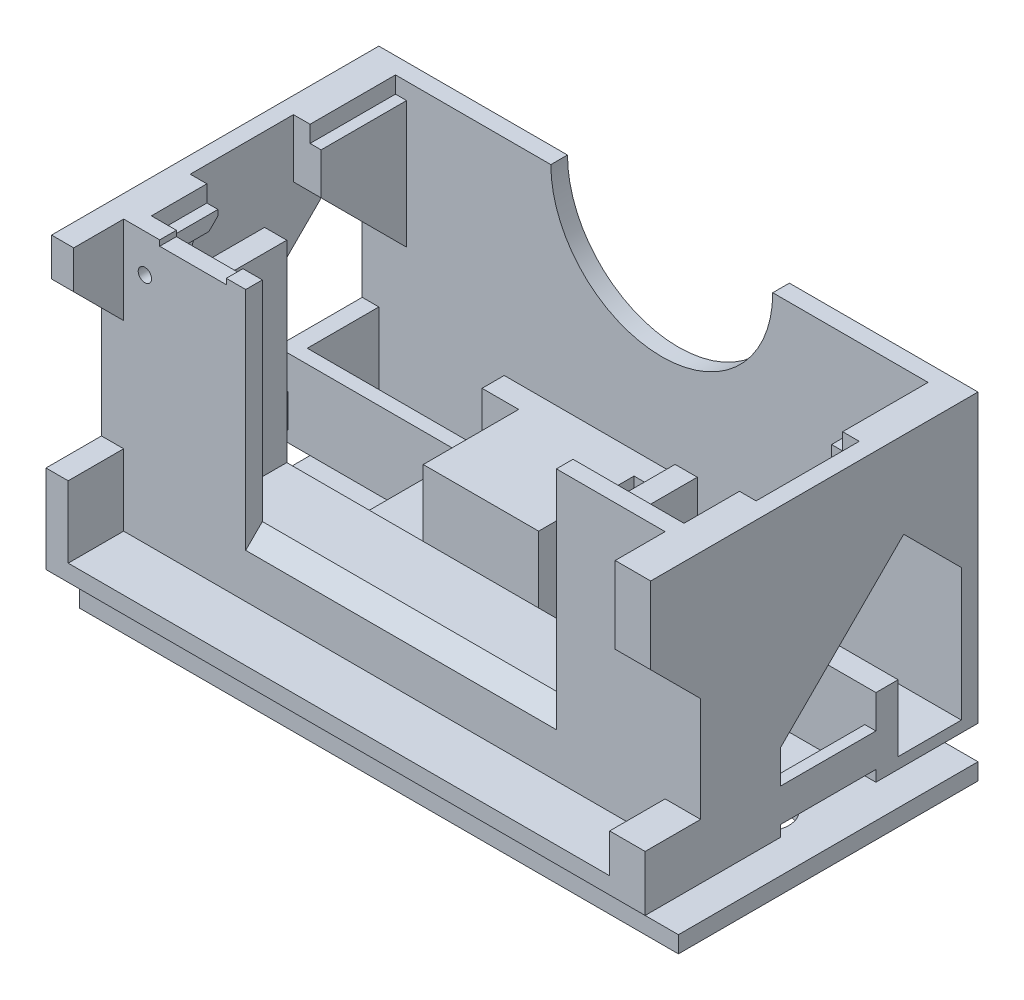
from build123d import *

# Parameters (mm, degrees)
SKETCH1_W                      = 54
SKETCH1_H                      = 27
BOSS_EXTRUDE1_DEPTH            = 1.5
CUT_EXTRUDE1_REACH             = 62.392
SKETCH2_R                      = 2.25
CUT_EXTRUDE1_DIRECTION_2_DEPTH = 61.392466418
SKETCH3_W                      = 26.4
SKETCH3_H                      = 30
BOSS_EXTRUDE2_DEPTH            = 3
CHAMFER3_SIZE                  = 3
BOSS_EXTRUDE3_DEPTH            = 7
SKETCH25_W                     = 8.6
SKETCH25_H                     = 3
BOSS_EXTRUDE19_DEPTH           = 1
BOSS_EXTRUDE15_START           = 7
SKETCH4_4_W                    = 10.4
SKETCH4_4_H                    = 8.6
BOSS_EXTRUDE15_DEPTH           = 6
SKETCH5_W                      = 54
SKETCH5_H                      = 1.5
BOSS_EXTRUDE5_DEPTH            = 18.86
SKETCH5_3_W                    = 2
SKETCH5_3_H                    = 5.7
BOSS_EXTRUDE6_DEPTH            = 17.36
SKETCH4_3_W                    = 8
SKETCH4_3_H                    = 8.6
BOSS_EXTRUDE12_DEPTH           = 3.86
SKETCH17_W                     = 2
SKETCH17_H                     = 6.43
SKETCH17_W_2                   = 3.2
SKETCH17_H_2                   = 3.5
BOSS_EXTRUDE13_DEPTH           = 5
SKETCH17_3_W                   = 2
SKETCH17_3_H                   = 7.93
SKETCH17_3_W_2                 = 3.2
SKETCH17_3_H_2                 = 11.43
BOSS_EXTRUDE16_DEPTH           = 4.5
CHAMFER7_SIZE                  = 4.5
SKETCH5_4_W                    = 54
SKETCH5_4_H                    = 1.5
BOSS_EXTRUDE8_DEPTH            = 18.86
BOSS_EXTRUDE9_DEPTH            = 1.5
SKETCH18_W                     = 4
SKETCH18_H                     = 7.7
BOSS_EXTRUDE14_DEPTH           = 13
SKETCH18_3_W                   = 2.5
SKETCH18_3_H                   = 5
BOSS_EXTRUDE17_DEPTH           = 7
CHAMFER8_SIZE                  = 5
CHAMFER6_SIZE                  = 7.75
SKETCH20_W                     = 1
SKETCH20_H                     = 7.7
SKETCH20_H_2                   = 5
CUT_EXTRUDE7_DEPTH             = 1.5
SKETCH22_W                     = 6
SKETCH22_H                     = 1.5
CUT_EXTRUDE10_DEPTH            = 0.5
SKETCH12_W                     = 28
SKETCH12_H                     = 18.86
CUT_EXTRUDE2_DEPTH             = 7.2
CUT_EXTRUDE3_DEPTH             = 1.5
SKETCH15_W                     = 9
SKETCH15_H                     = 2
BOSS_EXTRUDE11_DEPTH           = 6
SKETCH21_W                     = 18.5
SKETCH21_H                     = 5.7
SKETCH21_H_2                   = 0.75
CUT_EXTRUDE8_DEPTH             = 6
CUT_EXTRUDE9_START             = -6
SKETCH21_3_W                   = 18.5
SKETCH21_3_H                   = 5.7
SKETCH21_3_H_2                 = 0.75
CUT_EXTRUDE9_DEPTH             = 1
FILLET7_R                      = 1
CUT_EXTRUDE11_REACH            = 68.804
SKETCH23_R                     = 0.6
CHAMFER9_SIZE                  = 1.5
BOSS_EXTRUDE18_REACH           = 67.757
SKETCH24_W                     = 1.5
SKETCH24_H                     = 7


# Some blends are built 0.0001 mm under size
with BuildPart() as part:
    # Sketch1 → Boss-Extrude1 (new body)
    with BuildSketch(Plane(origin=(0, 0, 0), x_dir=(1, 0, 0), z_dir=(0, 1, 0))):
        with Locations((27, 13.5)):
            Rectangle(SKETCH1_W, SKETCH1_H)
    extrude(amount=BOSS_EXTRUDE1_DEPTH)

    # Sketch2 → Cut-Extrude1 (cut, up to next)
    with BuildSketch(Plane(origin=(0, 1.5, 0), x_dir=(1, 0, 0), z_dir=(0, 1, 0)), mode=Mode.PRIVATE) as cut_extrude1_sk1:
        with Locations(Location((5.8, 13.5, 0), (0, 0, 90))):
            Circle(SKETCH2_R)
    cut_extrude1_tool1 = extrude(cut_extrude1_sk1.sketch, amount=-CUT_EXTRUDE1_REACH, mode=Mode.PRIVATE) & part.part
    cut_extrude1 = cut_extrude1_tool1.solids().sort_by_distance((5.8, 1.5, -13.5))[0]
    add(cut_extrude1, mode=Mode.SUBTRACT)

    # Sketch2 → Cut-Extrude1 direction 2 (cut)
    with BuildSketch(Plane(origin=(0, 1.5, 0), x_dir=(1, 0, 0), z_dir=(0, 1, 0))):
        with Locations(Location((5.8, 13.5, 0), (0, 0, 90))):
            Circle(SKETCH2_R)
    cut_extrude1_direction_2 = extrude(amount=CUT_EXTRUDE1_DIRECTION_2_DEPTH, mode=Mode.SUBTRACT)

    # Mirror1: Cut-Extrude1, Cut-Extrude1 direction 2 across plane
    add(cut_extrude1.mirror(Plane.ZY.offset(-27)), mode=Mode.SUBTRACT)
    add(cut_extrude1_direction_2.mirror(Plane.ZY.offset(-27)), mode=Mode.SUBTRACT)

    # Sketch3 → Boss-Extrude2 (add)
    with BuildSketch(Plane(origin=(0, 1.5, 0), x_dir=(1, 0, 0), z_dir=(0, 1, 0))):
        with Locations((27, 12)):
            Rectangle(SKETCH3_W, SKETCH3_H)
    extrude(amount=BOSS_EXTRUDE2_DEPTH)

    # Chamfer3
    chamfer3_edges = [part.edges().sort_by_distance(p)[0] for p in [
        (27, 1.5, 3),
    ]]
    chamfer(chamfer3_edges, length=CHAMFER3_SIZE - 0.0001)  # a hair under: the kernel refuses the full size

    # Sketch4 → Boss-Extrude3 (add)
    with BuildSketch(Plane(origin=(0, 4.5, 0), x_dir=(1, 0, 0), z_dir=(0, 1, 0))):
        Polygon((54, 27), (0, 27), (0, 17.8), (21.8, 17.8), (21.8, 9.2), (0, 9.2), (0, 2), (54, 2), (54, 9.2), (32.2, 9.2), (32.2, 17.8), (54, 17.8), align=None)
    extrude(amount=BOSS_EXTRUDE3_DEPTH)

    # Sketch25 → Boss-Extrude19 (add)
    with BuildSketch(Plane(origin=(54, 0, 0), x_dir=(0, 0, -1), z_dir=(1, 0, 0))):
        with Locations((13.5, 7)):
            Rectangle(SKETCH25_W, SKETCH25_H)
    boss_extrude19 = extrude(amount=-BOSS_EXTRUDE19_DEPTH)

    # Mirror6: Boss-Extrude19 across plane
    add(boss_extrude19.mirror(Plane.ZY.offset(-27)))

    # Sketch4<4> → Boss-Extrude15 (add)
    with BuildSketch(Plane(origin=(0, 4.5, 0), x_dir=(1, 0, 0), z_dir=(0, 1, 0)).offset(BOSS_EXTRUDE15_START)):
        with Locations((27, 13.5)):
            Rectangle(SKETCH4_4_W, SKETCH4_4_H)
    extrude(amount=BOSS_EXTRUDE15_DEPTH)

    # Sketch5 → Boss-Extrude5 (add)
    with BuildSketch(Plane(origin=(0, 11.5, 0), x_dir=(1, 0, 0), z_dir=(0, 1, 0))):
        with Locations((27, 2.75)):
            Rectangle(SKETCH5_W, SKETCH5_H)
    extrude(amount=BOSS_EXTRUDE5_DEPTH)

    # Sketch5<3> → Boss-Extrude6 (add)
    with BuildSketch(Plane(origin=(0, 11.5, 0), x_dir=(1, 0, 0), z_dir=(0, 1, 0))):
        with Locations((45.5, 6.35)):
            Rectangle(SKETCH5_3_W, SKETCH5_3_H)
        with Locations((8.5, 6.35)):
            Rectangle(SKETCH5_3_W, SKETCH5_3_H)
    extrude(amount=BOSS_EXTRUDE6_DEPTH)

    # Sketch4<3> → Boss-Extrude12 (add)
    with BuildSketch(Plane(origin=(0, 4.5, 0), x_dir=(1, 0, 0), z_dir=(0, 1, 0))):
        with Locations((17.8, 13.5)):
            Rectangle(SKETCH4_3_W, SKETCH4_3_H)
        with Locations((36.2, 13.5)):
            Rectangle(SKETCH4_3_W, SKETCH4_3_H)
    extrude(amount=BOSS_EXTRUDE12_DEPTH)

    # Sketch17 → Boss-Extrude13 (add)
    with BuildSketch(Plane.XY.offset(-2)):
        with Locations((1, 9.215)):
            Rectangle(SKETCH17_W, SKETCH17_H)
        Polygon((0, 6), (0, 4.5), (13.8, 4.5), (40.2, 4.5), (54, 4.5), (54, 6), (50.8, 6), (2, 6), align=None)
        with Locations((52.4, 7.75)):
            Rectangle(SKETCH17_W_2, SKETCH17_H_2)
    extrude(amount=BOSS_EXTRUDE13_DEPTH)

    # Sketch17<3> → Boss-Extrude16 (add)
    with BuildSketch(Plane.XY.offset(-2)):
        with Locations((1, 26.395)):
            Rectangle(SKETCH17_3_W, SKETCH17_3_H)
        with Locations((52.4, 24.645)):
            Rectangle(SKETCH17_3_W_2, SKETCH17_3_H_2)
    extrude(amount=BOSS_EXTRUDE16_DEPTH)

    # Chamfer7
    chamfer7_edges = [part.edges().sort_by_distance(p)[0] for p in [
        (52.4, 18.93, 2.5),
        (1, 22.43, 2.5),
    ]]
    chamfer(chamfer7_edges, length=CHAMFER7_SIZE - 0.0001)  # a hair under: the kernel refuses the full size

    # Sketch5<4> → Boss-Extrude8 (add)
    with BuildSketch(Plane(origin=(0, 11.5, 0), x_dir=(1, 0, 0), z_dir=(0, 1, 0))):
        with Locations((27, 26.25)):
            Rectangle(SKETCH5_4_W, SKETCH5_4_H)
    extrude(amount=BOSS_EXTRUDE8_DEPTH)

    # Sketch10 → Boss-Extrude9 (add)
    with BuildSketch(Plane.ZY):
        Polygon((-3.5, 11.5), (-3.5, 30.36), (-25.5, 30.36), (-25.5, 27.8), (-9.2, 11.5), align=None)
    boss_extrude9 = extrude(amount=-BOSS_EXTRUDE9_DEPTH)

    # Mirror3: Boss-Extrude9 across plane
    add(boss_extrude9.mirror(Plane.ZY.offset(-27)))

    # Sketch18 → Boss-Extrude14 (add)
    with BuildSketch(Plane(origin=(0, 30.36, 0), x_dir=(1, 0, 0), z_dir=(0, 1, 0))):
        with Locations((2, 21.65)):
            Rectangle(SKETCH18_W, SKETCH18_H)
        with Locations((52, 21.65)):
            Rectangle(SKETCH18_W, SKETCH18_H)
    extrude(amount=-BOSS_EXTRUDE14_DEPTH)

    # Sketch18<3> → Boss-Extrude17 (add)
    with BuildSketch(Plane(origin=(0, 30.36, 0), x_dir=(1, 0, 0), z_dir=(0, 1, 0))):
        with Locations((51.25, 6)):
            Rectangle(SKETCH18_3_W, SKETCH18_3_H)
        with Locations((2.75, 6)):
            Rectangle(SKETCH18_3_W, SKETCH18_3_H)
    extrude(amount=-BOSS_EXTRUDE17_DEPTH)

    # Chamfer8
    chamfer8_edges = [part.edges().sort_by_distance(p)[0] for p in [
        (51.25, 23.36, -8.5),
        (2.75, 23.36, -8.5),
    ]]
    chamfer(chamfer8_edges, length=CHAMFER8_SIZE - 0.0001)  # a hair under: the kernel refuses the full size

    # Chamfer6
    # the kernel refuses this chamfer: 7.75 mm, written as the material it takes off along each edge
    with BuildSketch(Plane(origin=(-19.930543157, 17.36, -17.8), x_dir=(0, 0.9996219169112968, 0.027495876610586188), z_dir=(1, 0, 0))) as chamfer6_piece_1_section:
        Polygon((CHAMFER6_SIZE * 0.999621916911, -CHAMFER6_SIZE * 0.0274958766106), (-CHAMFER6_SIZE * 0.0274958766106, -CHAMFER6_SIZE * 0.999621916911), (0, 0), align=None)
    chamfer6_piece_1 = extrude(amount=43.861086313, mode=Mode.PRIVATE)
    chamfer6_piece_1 = split(chamfer6_piece_1, bisect_by=Plane(origin=(0.75, 21.216778897, -18.916778897), z_dir=(0, -0.7071067811865515, -0.7071067811865436)), keep=Keep.TOP, mode=Mode.PRIVATE)
    chamfer6_piece_1 = split(chamfer6_piece_1, bisect_by=Plane(origin=(0.75, 19.326101078, -25.5), z_dir=(0, 0, 1)), keep=Keep.TOP, mode=Mode.PRIVATE)
    add(chamfer6_piece_1, mode=Mode.SUBTRACT)
    with BuildSketch(Plane(origin=(-19.930543157, 17.36, -17.8), x_dir=(0, 0.9996219169112968, 0.027495876610586188), z_dir=(1, 0, 0))) as chamfer6_piece_2_section:
        Polygon((CHAMFER6_SIZE * 0.999621916911, -CHAMFER6_SIZE * 0.0274958766106), (-CHAMFER6_SIZE * 0.0274958766106, -CHAMFER6_SIZE * 0.999621916911), (0, 0), align=None)
    chamfer6_piece_2 = extrude(amount=43.861086313, mode=Mode.PRIVATE)
    chamfer6_piece_2 = split(chamfer6_piece_2, bisect_by=Plane(origin=(1.5, 22.605, -18.635), z_dir=(1, 0, 0)), keep=Keep.TOP, mode=Mode.PRIVATE)
    chamfer6_piece_2 = split(chamfer6_piece_2, bisect_by=Plane(origin=(2.75, 17.5, -18.635), z_dir=(0, 1, 0)), keep=Keep.TOP, mode=Mode.PRIVATE)
    add(chamfer6_piece_2, mode=Mode.SUBTRACT)
    with BuildSketch(Plane(origin=(30.069456843, 17.36, -17.8), x_dir=(0, 0.9996219169112968, 0.027495876610586188), z_dir=(1, 0, 0))) as chamfer6_piece_3_section:
        Polygon((CHAMFER6_SIZE * 0.999621916911, -CHAMFER6_SIZE * 0.0274958766106), (-CHAMFER6_SIZE * 0.0274958766106, -CHAMFER6_SIZE * 0.999621916911), (0, 0), align=None)
    chamfer6_piece_3 = extrude(amount=43.861086313, mode=Mode.PRIVATE)
    chamfer6_piece_3 = split(chamfer6_piece_3, bisect_by=Plane(origin=(51.25, 22.605, -25.5), z_dir=(0, 0, 1)), keep=Keep.TOP, mode=Mode.PRIVATE)
    chamfer6_piece_3 = split(chamfer6_piece_3, bisect_by=Plane(origin=(52.5, 22.605, -18.635), z_dir=(-1, 0, 0)), keep=Keep.TOP, mode=Mode.PRIVATE)
    add(chamfer6_piece_3, mode=Mode.SUBTRACT)
    with BuildSketch(Plane(origin=(30.069456843, 17.36, -17.8), x_dir=(0, 0.9996219169112968, 0.027495876610586188), z_dir=(1, 0, 0))) as chamfer6_piece_4_section:
        Polygon((CHAMFER6_SIZE * 0.999621916911, -CHAMFER6_SIZE * 0.0274958766106), (-CHAMFER6_SIZE * 0.0274958766106, -CHAMFER6_SIZE * 0.999621916911), (0, 0), align=None)
    chamfer6_piece_4 = extrude(amount=43.861086313, mode=Mode.PRIVATE)
    chamfer6_piece_4 = split(chamfer6_piece_4, bisect_by=Plane(origin=(53.25, 19.326101078, -25.5), z_dir=(0, 0, 1)), keep=Keep.TOP, mode=Mode.PRIVATE)
    chamfer6_piece_4 = split(chamfer6_piece_4, bisect_by=Plane(origin=(53.25, 21.216778897, -18.916778897), z_dir=(0, -0.7071067811865515, -0.7071067811865436)), keep=Keep.TOP, mode=Mode.PRIVATE)
    add(chamfer6_piece_4, mode=Mode.SUBTRACT)

    # Sketch20 → Cut-Extrude7 (cut)
    with BuildSketch(Plane(origin=(0, 30.36, 0), x_dir=(1, 0, 0), z_dir=(0, 1, 0))):
        with Locations((3.5, 21.65)):
            Rectangle(SKETCH20_W, SKETCH20_H)
        with Locations((50.5, 21.65)):
            Rectangle(SKETCH20_W, SKETCH20_H)
        with Locations((3.5, 6)):
            Rectangle(SKETCH20_W, SKETCH20_H_2)
        with Locations((50.5, 6)):
            Rectangle(SKETCH20_W, SKETCH20_H_2)
    extrude(amount=-CUT_EXTRUDE7_DEPTH, mode=Mode.SUBTRACT)

    # Sketch22 → Cut-Extrude10 (cut)
    with BuildSketch(Plane(origin=(0, 30.36, 0), x_dir=(1, 0, 0), z_dir=(0, 1, 0))):
        with Locations((8.25, 2.75)):
            Rectangle(SKETCH22_W, SKETCH22_H)
    extrude(amount=-CUT_EXTRUDE10_DEPTH, mode=Mode.SUBTRACT)

    # Sketch12 → Cut-Extrude2 (cut)
    with BuildSketch(Plane.XY.offset(-2)):
        with Locations((27, 20.93)):
            Rectangle(SKETCH12_W, SKETCH12_H)
    extrude(amount=-CUT_EXTRUDE2_DEPTH, mode=Mode.SUBTRACT)

    # Sketch14 → Cut-Extrude3 (cut)
    with BuildSketch(Plane(origin=(0, 0, -27), x_dir=(-1, 0, 0), z_dir=(0, 0, -1))):
        with BuildLine():
            ThreePointArc((-17, 30.36), (-27, 40.36), (-37, 30.36))
            Line((-37, 30.36), (-17, 30.36))
        make_face()
        with BuildLine():
            Line((-17, 30.36), (-37, 30.36))
            ThreePointArc((-37, 30.36), (-27, 20.36), (-17, 30.36))
        make_face()
    extrude(amount=-CUT_EXTRUDE3_DEPTH, mode=Mode.SUBTRACT)

    # Sketch15 → Boss-Extrude11 (add)
    with BuildSketch(Plane(origin=(0, 11.5, 0), x_dir=(1, 0, 0), z_dir=(0, 1, 0))):
        with Locations((23, 18.8)):
            Rectangle(SKETCH15_W, SKETCH15_H)
    boss_extrude11 = extrude(amount=BOSS_EXTRUDE11_DEPTH)

    # Mirror5: Boss-Extrude11 across plane
    add(boss_extrude11.mirror(Plane.ZY.offset(-27)))

    # Sketch21 → Cut-Extrude8 (cut)
    with BuildSketch(Plane(origin=(0, 11.5, 0), x_dir=(1, 0, 0), z_dir=(0, 1, 0))):
        Polygon((54, 25.5), (18.5, 25.5), (18.5, 19.8), (35.5, 19.8), (54, 19.8), align=None)
        with Locations((9.25, 22.65)):
            Rectangle(SKETCH21_W, SKETCH21_H)
        with Locations((9.25, 19.425)):
            Rectangle(SKETCH21_W, SKETCH21_H_2)
    extrude(amount=-CUT_EXTRUDE8_DEPTH, mode=Mode.SUBTRACT)

    # Sketch21<3> → Cut-Extrude9 (cut)
    with BuildSketch(Plane(origin=(0, 11.5, 0), x_dir=(1, 0, 0), z_dir=(0, 1, 0)).offset(CUT_EXTRUDE9_START)):
        with Locations((9.25, 22.65)):
            Rectangle(SKETCH21_3_W, SKETCH21_3_H)
        with Locations((9.25, 19.425)):
            Rectangle(SKETCH21_3_W, SKETCH21_3_H_2)
    extrude(amount=-CUT_EXTRUDE9_DEPTH, mode=Mode.SUBTRACT)

    # Fillet7
    fillet7_edges = [part.edges().sort_by_distance(p)[0] for p in [
        (1.5, 17.43, -3.5),
        (52.5, 17.43, -3.5),
    ]]
    fillet(fillet7_edges, radius=FILLET7_R)

    # Sketch23 → Cut-Extrude11 (cut, up to next)
    with BuildSketch(Plane.XY.offset(-2), mode=Mode.PRIVATE) as cut_extrude11_sk1:
        with Locations((3.91, 26.95)):
            Circle(SKETCH23_R)
    cut_extrude11_tool1 = extrude(cut_extrude11_sk1.sketch, amount=-CUT_EXTRUDE11_REACH, mode=Mode.PRIVATE) & part.part
    # Sketch23 → Cut-Extrude11 (cut, up to next)
    with BuildSketch(Plane.XY.offset(-2), mode=Mode.PRIVATE) as cut_extrude11_sk2:
        with Locations((48.89, 26.95)):
            Circle(SKETCH23_R)
    cut_extrude11_tool2 = extrude(cut_extrude11_sk2.sketch, amount=-CUT_EXTRUDE11_REACH, mode=Mode.PRIVATE) & part.part
    add(cut_extrude11_tool1.solids().sort_by_distance((3.91, 26.95, -2))[0], mode=Mode.SUBTRACT)
    add(cut_extrude11_tool2.solids().sort_by_distance((48.89, 26.95, -2))[0], mode=Mode.SUBTRACT)

    # Chamfer9
    chamfer9_edges = [part.edges().sort_by_distance(p)[0] for p in [
        (27, 11.5, -2),
    ]]
    chamfer(chamfer9_edges, length=CHAMFER9_SIZE)

    # Sketch24 → Boss-Extrude18 (add, up to next)
    with BuildSketch(Plane(origin=(0, 0, -19.05), x_dir=(-1, 0, 0), z_dir=(0, 0, -1)), mode=Mode.PRIVATE) as boss_extrude18_sk1:
        with Locations((-0.75, 8)):
            Rectangle(SKETCH24_W, SKETCH24_H)
    boss_extrude18_tool1 = extrude(boss_extrude18_sk1.sketch, amount=BOSS_EXTRUDE18_REACH, mode=Mode.PRIVATE) - part.part
    add(boss_extrude18_tool1.solids().sort_by_distance((0.75, 8, -19.05))[0])


solid = part.part
